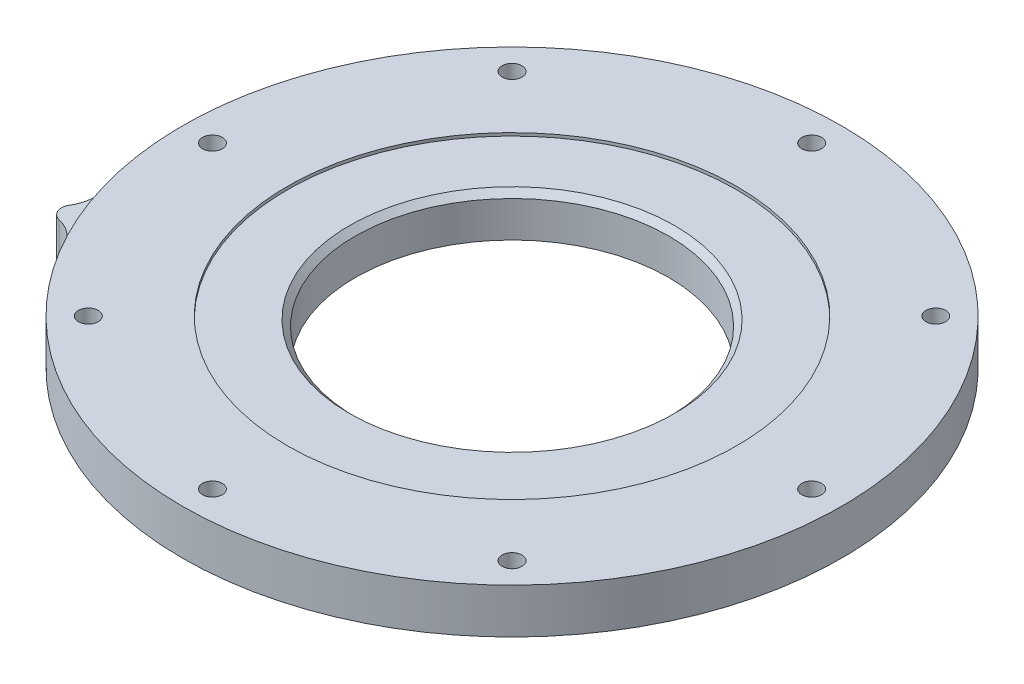
from build123d import *
from build123d.topology import SkipClean

# Parameters (mm, degrees)
SKETCH1_R           = 55
SKETCH1_R_2         = 37.5
SKETCH1_R_3         = 1.65
BOSS_EXTRUDE1_DEPTH = 0.5
BOSS_EXTRUDE2_START = 7
SKETCH2_R           = 26.15
SKETCH2_R_2         = 1.65
BOSS_EXTRUDE2_DEPTH = 7
CHAMFER1_SIZE       = 1
SKETCH3_R           = 3.65
SKETCH3_R_2         = 1.65
CUT_EXTRUDE1_DEPTH  = 4


with BuildPart() as part:
    # Sketch1 → Boss-Extrude1 (new body)
    with BuildSketch(Plane(origin=(0, 0, 0), x_dir=(1, 0, 0), z_dir=(0, 1, 0))):
        Circle(SKETCH1_R)
        Circle(SKETCH1_R_2, mode=Mode.SUBTRACT)
        with Locations((0, 50)):
            Circle(SKETCH1_R_3, mode=Mode.SUBTRACT)
        with Locations((35.355339059, 35.355339059)):
            Circle(SKETCH1_R_3, mode=Mode.SUBTRACT)
        with Locations((50, 0)):
            Circle(SKETCH1_R_3, mode=Mode.SUBTRACT)
        with Locations((35.355339059, -35.355339059)):
            Circle(SKETCH1_R_3, mode=Mode.SUBTRACT)
        with Locations((0, -50)):
            Circle(SKETCH1_R_3, mode=Mode.SUBTRACT)
        with Locations((-35.355339059, -35.355339059)):
            Circle(SKETCH1_R_3, mode=Mode.SUBTRACT)
        with Locations((-50, 0)):
            Circle(SKETCH1_R_3, mode=Mode.SUBTRACT)
        with Locations((-35.355339059, 35.355339059)):
            Circle(SKETCH1_R_3, mode=Mode.SUBTRACT)
    extrude(amount=BOSS_EXTRUDE1_DEPTH)

    # Sketch2 → Boss-Extrude2 (add)
    with SkipClean():  # the faces are left unmerged after this step: merging them gives an invalid solid
        with BuildSketch(Plane.XZ.offset(BOSS_EXTRUDE2_START)):
            with BuildLine():
                ThreePointArc((-52.76902678, 15.505799326), (50.813374288, -21.04758878), (-48.277592523, 26.349080822))
                ThreePointArc((-48.277592523, 26.349080822), (-49.915423513, 24.445273361), (-52.189000111, 23.37858566))
                ThreePointArc((-52.189000111, 23.37858566), (-53.585012886, 22.195639077), (-53.434352336, 20.372039427))
                ThreePointArc((-53.434352336, 20.372039427), (-52.580953013, 18.01011589), (-52.76902678, 15.505799326))
            make_face()
            Circle(SKETCH2_R, mode=Mode.SUBTRACT)
            with Locations((0, -50)):
                Circle(SKETCH2_R_2, mode=Mode.SUBTRACT)
            with Locations((35.355339059, -35.355339059)):
                Circle(SKETCH2_R_2, mode=Mode.SUBTRACT)
            with Locations((50, 0)):
                Circle(SKETCH2_R_2, mode=Mode.SUBTRACT)
            with Locations((35.355339059, 35.355339059)):
                Circle(SKETCH2_R_2, mode=Mode.SUBTRACT)
            with Locations((0, 50)):
                Circle(SKETCH2_R_2, mode=Mode.SUBTRACT)
            with Locations((-35.355339059, 35.355339059)):
                Circle(SKETCH2_R_2, mode=Mode.SUBTRACT)
            with Locations((-50, 0)):
                Circle(SKETCH2_R_2, mode=Mode.SUBTRACT)
            with Locations((-35.355339059, -35.355339059)):
                Circle(SKETCH2_R_2, mode=Mode.SUBTRACT)
        extrude(amount=-BOSS_EXTRUDE2_DEPTH)

    # Chamfer1
    chamfer1_edges = [part.edges().sort_by_distance(p)[0] for p in [
        (-26.15, 0, 0),
    ]]
    chamfer(chamfer1_edges, length=CHAMFER1_SIZE)

    # Sketch3 → Cut-Extrude1 (cut)
    # profile 1 of 8: a face of its own
    with SkipClean():  # the faces are left unmerged after this step: merging them gives an invalid solid
        with BuildSketch(Plane.XZ.offset(7)):
            with Locations((-50, 0)):
                Circle(SKETCH3_R)
            with Locations((-50, 0)):
                Circle(SKETCH3_R_2, mode=Mode.SUBTRACT)
        # profile 2 of 8: a face of its own
        with BuildSketch(Plane.XZ.offset(7)):
            with Locations((-35.355339059, -35.355339059)):
                Circle(SKETCH3_R)
            with Locations((-35.355339059, -35.355339059)):
                Circle(SKETCH3_R_2, mode=Mode.SUBTRACT)
        # profile 3 of 8: a face of its own
        with BuildSketch(Plane.XZ.offset(7)):
            with Locations((0, -50)):
                Circle(SKETCH3_R)
            with Locations((0, -50)):
                Circle(SKETCH3_R_2, mode=Mode.SUBTRACT)
        # profile 4 of 8: a face of its own
        with BuildSketch(Plane.XZ.offset(7)):
            with Locations((35.355339059, -35.355339059)):
                Circle(SKETCH3_R)
            with Locations((35.355339059, -35.355339059)):
                Circle(SKETCH3_R_2, mode=Mode.SUBTRACT)
        # profile 5 of 8: a face of its own
        with BuildSketch(Plane.XZ.offset(7)):
            with Locations((50, 0)):
                Circle(SKETCH3_R)
            with Locations((50, 0)):
                Circle(SKETCH3_R_2, mode=Mode.SUBTRACT)
        # profile 6 of 8: a face of its own
        with BuildSketch(Plane.XZ.offset(7)):
            with Locations((35.355339059, 35.355339059)):
                Circle(SKETCH3_R)
            with Locations((35.355339059, 35.355339059)):
                Circle(SKETCH3_R_2, mode=Mode.SUBTRACT)
        # profile 7 of 8: a face of its own
        with BuildSketch(Plane.XZ.offset(7)):
            with Locations((0, 50)):
                Circle(SKETCH3_R)
            with Locations((0, 50)):
                Circle(SKETCH3_R_2, mode=Mode.SUBTRACT)
        # profile 8 of 8: a face of its own
        with BuildSketch(Plane.XZ.offset(7)):
            with Locations((-35.355339059, 35.355339059)):
                Circle(SKETCH3_R)
            with Locations((-35.355339059, 35.355339059)):
                Circle(SKETCH3_R_2, mode=Mode.SUBTRACT)
        extrude(amount=-CUT_EXTRUDE1_DEPTH, mode=Mode.SUBTRACT)


solid = part.part
